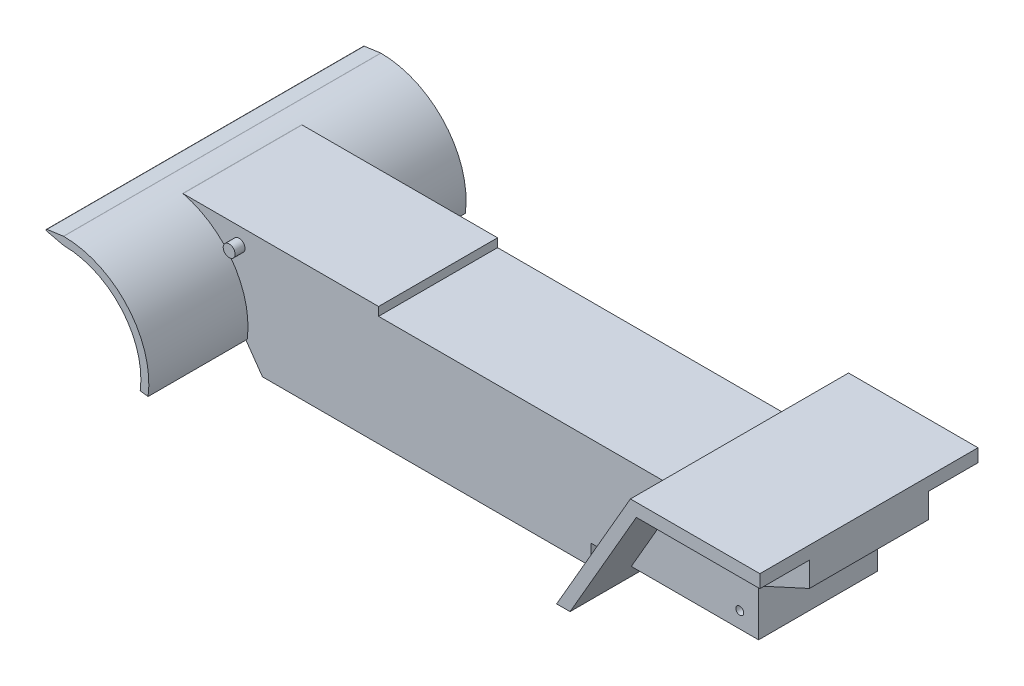
from build123d import *

# Parameters (mm, degrees)
SKETCH1_R                = 50.8
BOSS_EXTRUDE1_DEPTH      = 1524
BOSS_EXTRUDE2_DEPTH      = 1270
BOSS_EXTRUDE2_DEPTH_BACK = 2794
BOSS_EXTRUDE3_DEPTH      = 635
BOSS_EXTRUDE3_DEPTH_BACK = 2159
BOSS_EXTRUDE5_DEPTH      = 127
BOSS_EXTRUDE5_DEPTH_BACK = 1651
SKETCH5_R                = 76.2
BOSS_EXTRUDE6_DEPTH      = 4064
BOSS_EXTRUDE7_START      = -4064
BOSS_EXTRUDE7_DEPTH      = 4064
FILLET1_R                = 20.32
FILLET2_R                = 15.24
FILLET3_R                = 15.24
FILLET4_R                = 15.24
FILLET5_R                = 15.24
SKETCH4_W                = 3795.653322381
SKETCH4_H                = 109.522208094
CUT_EXTRUDE1_DEPTH       = 1524


with BuildPart() as part:
    # Sketch1 → Boss-Extrude1 (new body)
    with BuildSketch(Plane.XY):
        Polygon((0, 288.639346487), (468.613209277, 288.639346487), (468.613209277, 644.7339374), (1051.2960708, 644.7339374), (1178.553429838, 462.986885422), (1502.731938743, 0), (5713.284119233, 0), (5713.284119233, 259.241704477), (7857.552449038, 259.241704477), (7857.552449038, 856.878061068), (8509, 1155.479490671), (8509, 1524), (0, 1524), align=None)
        with Locations((224.995009204, 462.986885422)):
            Circle(SKETCH1_R, mode=Mode.SUBTRACT)
        with Locations((7616.395009204, 462.986885422)):
            Circle(SKETCH1_R, mode=Mode.SUBTRACT)
    extrude(amount=BOSS_EXTRUDE1_DEPTH)

    # Sketch2 → Boss-Extrude2 (add, two sides: drawn at the far end of the back side and taken through both)
    with BuildSketch(Plane.XY.offset(1524).offset(-BOSS_EXTRUDE2_DEPTH_BACK)):
        with BuildLine():
            Line((1206.862433225, 331.743898385), (1307.566784406, 318.283079202))
            ThreePointArc((1307.566784406, 318.283079202), (1046.86675624, 1182.311340326), (224.995009204, 1555.186885422))
            Line((224.995009204, 1555.186885422), (224.995009204, 1453.586885422))
            ThreePointArc((224.995009204, 1453.586885422), (970.413570469, 1115.397437544), (1206.862433225, 331.743898385))
        make_face()
    extrude(amount=BOSS_EXTRUDE2_DEPTH + BOSS_EXTRUDE2_DEPTH_BACK)

    # Sketch3 → Boss-Extrude3 (add, two sides: drawn at the far end of the back side and taken through both)
    with BuildSketch(Plane.XY.offset(1524).offset(-BOSS_EXTRUDE3_DEPTH_BACK)):
        Polygon((5905.638550103, 0), (6850.778261275, 1637.03), (8509, 1637.03), (8509, 1470.430007997), (6926.6918571, 1470.430007997), (6077.738696158, 0), align=None)
    extrude(amount=BOSS_EXTRUDE3_DEPTH + BOSS_EXTRUDE3_DEPTH_BACK)

    # Sketch5 → Boss-Extrude5 (add, two sides: drawn at the far end of the back side and taken through both)
    with BuildSketch(Plane.XY.offset(1524).offset(-BOSS_EXTRUDE5_DEPTH_BACK)):
        with Locations((1202.84340516, 1311.719073043)):
            Circle(SKETCH5_R)
    extrude(amount=BOSS_EXTRUDE5_DEPTH + BOSS_EXTRUDE5_DEPTH_BACK)

    # Sketch7 → Boss-Extrude6 (add, through all)
    with BuildSketch(Plane.XY.offset(2794)):
        Polygon((224.995009204, 1555.186885422), (0, 1524), (224.995009204, 1524), align=None)
    extrude(amount=-BOSS_EXTRUDE6_DEPTH)

    # Sketch8 → Boss-Extrude7 (add)
    with BuildSketch(Plane.XY.offset(2794).offset(BOSS_EXTRUDE7_START)):
        Polygon((0, 1506.772554526), (224.995009204, 1453.586885422), (224.995009204, 1524), (0, 1524), align=None)
    extrude(amount=BOSS_EXTRUDE7_DEPTH)

    # Fillet1
    fillet1_edges = [part.edges().sort_by_distance(p)[0] for p in [
        (224.995009204, 1555.186885422, 762),
    ]]
    fillet(fillet1_edges, radius=FILLET1_R)

    # Fillet2
    fillet2_edges = [part.edges().sort_by_distance(p)[0] for p in [
        (0, 1524, 762),
    ]]
    fillet(fillet2_edges, radius=FILLET2_R)

    # Fillet3
    fillet3_edges = [part.edges().sort_by_distance(p)[0] for p in [
        (484.132059225, 1524, 762),
    ]]
    fillet(fillet3_edges, radius=FILLET3_R)

    # Fillet4
    # the kernel refuses this fillet: 15.24 mm, written as the material it takes off along each edge
    with BuildSketch(Plane(origin=(0, 1506.772554526, 1524), x_dir=(0.9731797416711222, -0.23004606147667025, 0), z_dir=(0, 0, 1))) as fillet4_piece_1:
        with BuildLine():
            CenterArc((9.213734751, 15.24), FILLET4_R, 228.374143348, 41.625856652)
            Line((-0.909642728, 3.848124456), (-1.112110278, 3.620286945))
            ThreePointArc((-1.112110278, 3.620286945), (-0.751446549, 1.853944188), (-0.296625185, -0.07011804))
            Line((-0.296625185, -0.07011804), (0, -0.3048))
            Line((0, -0.3048), (9.213734751, -0.3048))
            Line((9.213734751, -0.3048), (9.213734751, 0))
        make_face()
    extrude(amount=1293.034336878, mode=Mode.SUBTRACT)

    # Fillet5
    # the kernel refuses this fillet: 15.24 mm, written as the material it takes off along each edge
    with BuildSketch(Plane(origin=(0, 1506.772554526, -1293.034336878), x_dir=(0.9731797416711221, -0.23004606147667092, 0), z_dir=(0, 0, 1))) as fillet5_piece_1:
        with BuildLine():
            CenterArc((9.213734751, 15.24), FILLET5_R, 228.374143348, 41.625856652)
            Line((-0.909642728, 3.848124456), (-1.112110278, 3.620286945))
            ThreePointArc((-1.112110278, 3.620286945), (-0.751446549, 1.853944188), (-0.296625185, -0.07011804))
            Line((-0.296625185, -0.07011804), (0, -0.3048))
            Line((0, -0.3048), (9.213734751, -0.3048))
            Line((9.213734751, -0.3048), (9.213734751, 0))
        make_face()
    extrude(amount=1293.034336878, mode=Mode.SUBTRACT)

    # Sketch4 → Cut-Extrude1 (cut)
    with BuildSketch(Plane.XY.offset(1524)):
        with Locations((4887.693699158, 1469.238895953)):
            Rectangle(SKETCH4_W, SKETCH4_H)
    extrude(amount=-CUT_EXTRUDE1_DEPTH, mode=Mode.SUBTRACT)


solid = part.part
